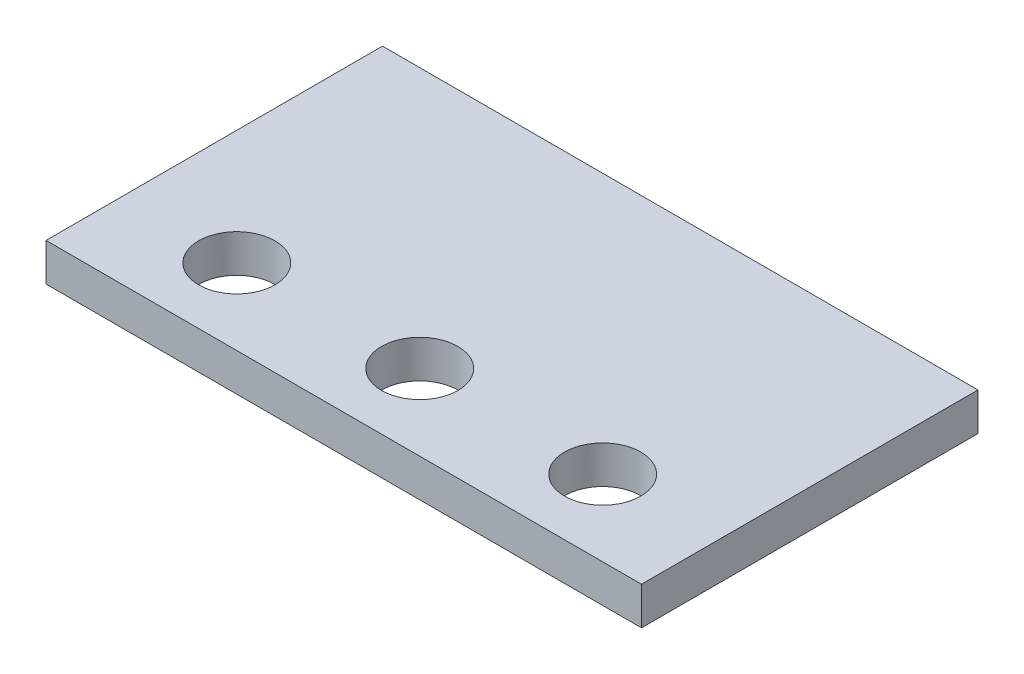
from build123d import *

# Parameters (mm, degrees)
CROQUIS1_W              = 315
CROQUIS1_H              = 20
SALIENTE_EXTRUIR1_DEPTH = 178
CORTAR_EXTRUIR1_REACH   = 398.622
CROQUIS2_R              = 20.190307202


with BuildPart() as part:
    # Croquis1 → Saliente-Extruir1 (new body)
    with BuildSketch(Plane(origin=(0, 0, 360), x_dir=(-1, 0, 0), z_dir=(0, 0, -1))):
        with Locations((7.754092983, -157.165586138)):
            Rectangle(CROQUIS1_W, CROQUIS1_H)
    extrude(amount=SALIENTE_EXTRUIR1_DEPTH)

    # Croquis2 → Cortar-Extruir1 (cut, up to next)
    with BuildSketch(Plane.XZ.offset(167.165586138), mode=Mode.PRIVATE) as cortar_extruir1_sk1:
        with Locations((-104.519454625, 319.809692798)):
            Circle(CROQUIS2_R)
    cortar_extruir1_tool1 = extrude(cortar_extruir1_sk1.sketch, amount=-CORTAR_EXTRUIR1_REACH, mode=Mode.PRIVATE) & part.part
    # Croquis2 → Cortar-Extruir1 (cut, up to next)
    with BuildSketch(Plane.XZ.offset(167.165586138), mode=Mode.PRIVATE) as cortar_extruir1_sk2:
        with Locations((-7.754092983, 319.809692798)):
            Circle(CROQUIS2_R)
    cortar_extruir1_tool2 = extrude(cortar_extruir1_sk2.sketch, amount=-CORTAR_EXTRUIR1_REACH, mode=Mode.PRIVATE) & part.part
    # Croquis2 → Cortar-Extruir1 (cut, up to next)
    with BuildSketch(Plane.XZ.offset(167.165586138), mode=Mode.PRIVATE) as cortar_extruir1_sk3:
        with Locations((89.011268658, 319.809692798)):
            Circle(CROQUIS2_R)
    cortar_extruir1_tool3 = extrude(cortar_extruir1_sk3.sketch, amount=-CORTAR_EXTRUIR1_REACH, mode=Mode.PRIVATE) & part.part
    add(cortar_extruir1_tool1.solids().sort_by_distance((-104.519455, -167.165586, 319.809693))[0], mode=Mode.SUBTRACT)
    add(cortar_extruir1_tool2.solids().sort_by_distance((-7.754093, -167.165586, 319.809693))[0], mode=Mode.SUBTRACT)
    add(cortar_extruir1_tool3.solids().sort_by_distance((89.011269, -167.165586, 319.809693))[0], mode=Mode.SUBTRACT)


solid = part.part
